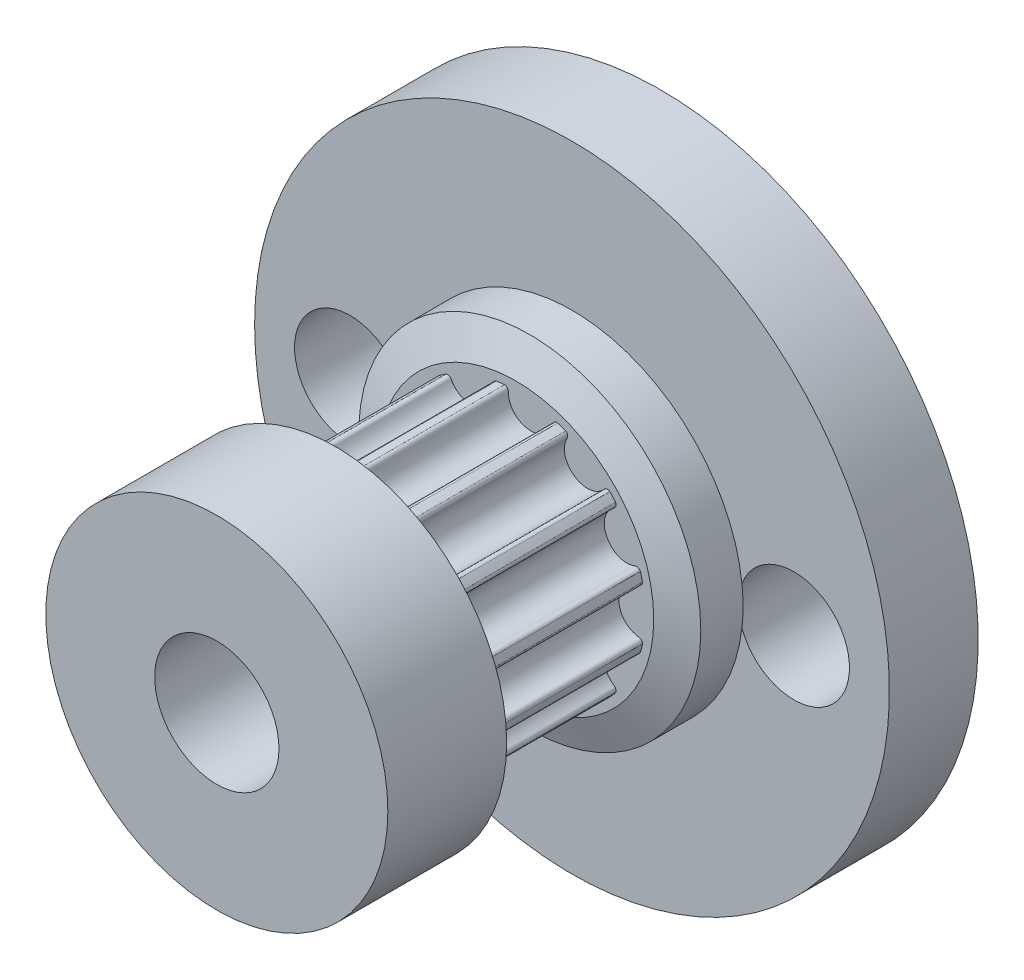
from build123d import *

# Parameters (mm, degrees)
TOOTHEXTRUDECUTGEARBELT01_DEPTH = 3.75179993
PATTERNGEARBELT01_COUNT         = 13
BOSS_EXTRUDE2_START             = -0.90326
SKETCH5_R                       = 7.705197088
BOSS_EXTRUDE2_DEPTH             = 1.90326
SKETCH6_R                       = 7.705197088
BOSS_EXTRUDE4_DEPTH             = 3.45
CUT_EXTRUDE2_START              = -15.0016
CUT_EXTRUDE2_DEPTH              = 34.543124234
BOSS_EXTRUDE3_START             = 1
SKETCH5_3_R                     = 14.3
SKETCH5_3_R_2                   = 2.5
SKETCH5_3_R_3                   = 2.8
BOSS_EXTRUDE3_DEPTH             = 4


with BuildPart() as part:
    # SketchRevolveGearBelt01 → GearBelt01 (revolve)
    with BuildSketch(Plane(origin=(0, 0, 0), x_dir=(0, 0, -1), z_dir=(1, 0, 0)), mode=Mode.PRIVATE) as gearbelt01_sk:
        Polygon((5.2757999, 0), (5.2757999, 5.190597126), (4.51379992, 5.190597126), (4.51379992, 6.055025889), (5.07653656, 7.413592317), (4.372540367, 7.705197088), (3.75179993, 6.206597107), (3.75179993, 5.825597113), (-3.75179993, 5.825597113), (-3.75179993, 6.206597107), (-4.372540367, 7.705197088), (-5.07653656, 7.413592317), (-4.51379992, 6.055025889), (-4.51379992, 5.190597126), (-5.2757999, 5.190597126), (-5.2757999, 0), align=None)
    revolve(gearbelt01_sk.sketch.rotate(Axis((0, 0, 0), (0, 0, -1)), 90), axis=Axis((0, 0, 0), (0, 0, -1)))

    # SketchToothGearBelt01 → ToothExtrudeCutGearBelt01 (cut, symmetric)
    with BuildSketch(Plane.XY):
        with BuildLine():
            ThreePointArc((5.694892079, 1.238985826), (5.82811133, 0), (5.694892079, -1.238985826))
            add(Edge.make_bspline(
                [(5.694892079, -1.238985826), (5.697177057, -1.228489495), (5.699194946, -1.212438974), (5.699015589, -1.190934318), (5.697447837, -1.174881659), (5.694459096, -1.159031946), (5.690073082, -1.143510711), (5.684324518, -1.128440876), (5.677258937, -1.113941791), (5.668932293, -1.100128287), (5.659410534, -1.087109759), (5.648769066, -1.07498933), (5.637092178, -1.063862917), (5.624472313, -1.053818916), (5.611009544, -1.044935833), (5.596810022, -1.03728791), (5.58198796, -1.030921195), (5.566654196, -1.025940308), (5.55095461, -1.022182426), (5.517566972, -1.018537534), (5.464967856, -1.005661424), (5.391433133, -0.99322849), (5.316880193, -0.971191628), (5.244078819, -0.944232687), (5.173663428, -0.911435203), (5.106015211, -0.873290054), (5.04156233, -0.829953387), (4.980696233, -0.781711646), (4.923790969, -0.728854955), (4.87119508, -0.671708794), (4.823231033, -0.610623043), (4.780192773, -0.545972238), (4.74234423, -0.478152621), (4.709916952, -0.407579931), (4.683111362, -0.334686642), (4.662085571, -0.259919934), (4.646991584, -0.183736684), (4.637835603, -0.106609111), (4.635765562, -0.050027961), (4.635859666, -0.014500084), (4.635846864, 0), (4.635859666, 0.014500084), (4.635765562, 0.050027961), (4.637835603, 0.106609111), (4.646991584, 0.183736684), (4.662085571, 0.259919934), (4.683111362, 0.334686642), (4.709916952, 0.407579931), (4.74234423, 0.478152621), (4.780192773, 0.545972238), (4.823231033, 0.610623043), (4.87119508, 0.671708794), (4.923790969, 0.728854955), (4.980696233, 0.781711646), (5.04156233, 0.829953387), (5.106015211, 0.873290054), (5.173663428, 0.911435203), (5.244078819, 0.944232687), (5.316880193, 0.971191628), (5.391433133, 0.99322849), (5.464967856, 1.005661424), (5.517566972, 1.018537534), (5.55095461, 1.022182426), (5.566654196, 1.025940308), (5.58198796, 1.030921195), (5.596810022, 1.03728791), (5.611009544, 1.044935833), (5.624472313, 1.053818916), (5.637092178, 1.063862917), (5.648769066, 1.07498933), (5.659410534, 1.087109759), (5.668932293, 1.100128287), (5.677258937, 1.113941791), (5.684324518, 1.128440876), (5.690073082, 1.143510711), (5.694459096, 1.159031946), (5.697447837, 1.174881659), (5.699015589, 1.190934318), (5.699194946, 1.212438974), (5.697177057, 1.228489495), (5.694892079, 1.238985826)],
                knots=[0, 0, 0, 0, 0.008948615, 0.013422922, 0.01789723, 0.022371537, 0.026845844, 0.031320152, 0.035794459, 0.040268767, 0.044743074, 0.049217381, 0.053691689, 0.058165996, 0.062640304, 0.067114611, 0.071588919, 0.076063226, 0.080537533, 0.085011841, 0.104016804, 0.125568346, 0.147119888, 0.168671431, 0.190222973, 0.211774515, 0.233326058, 0.2548776, 0.276429142, 0.297980685, 0.319532227, 0.341083769, 0.362635312, 0.384186854, 0.405738396, 0.427289939, 0.448841481, 0.470393024, 0.491944566, 0.495972283, 0.5, 0.504027717, 0.508055434, 0.529606976, 0.551158519, 0.572710061, 0.594261604, 0.615813146, 0.637364688, 0.658916231, 0.680467773, 0.702019315, 0.723570858, 0.7451224, 0.766673942, 0.788225485, 0.809777027, 0.831328569, 0.852880112, 0.874431654, 0.895983196, 0.914988159, 0.919462467, 0.923936774, 0.928411081, 0.932885389, 0.937359696, 0.941834004, 0.946308311, 0.950782619, 0.955256926, 0.959731233, 0.964205541, 0.968679848, 0.973154156, 0.977628463, 0.98210277, 0.986577078, 0.991051385, 1, 1, 1, 1], degree=3))
        make_face()
    toothextrudecutgearbelt01 = extrude(amount=TOOTHEXTRUDECUTGEARBELT01_DEPTH, both=True, mode=Mode.SUBTRACT)

    # PatternGearBelt01: ToothExtrudeCutGearBelt01 ×13 about axis
    patterngearbelt01_axis = Axis((0, 0, 55), (0, 0, -1))
    for i in range(1, PATTERNGEARBELT01_COUNT):
        add(toothextrudecutgearbelt01.rotate(patterngearbelt01_axis, i * 360 / PATTERNGEARBELT01_COUNT), mode=Mode.SUBTRACT)

    # Sketch5 → Boss-Extrude2 (add)
    with BuildSketch(Plane(origin=(0, 0, -5.2757999), x_dir=(-1, 0, 0), z_dir=(0, 0, -1)).offset(BOSS_EXTRUDE2_START)):
        with Locations(Location((0, 0, 0), (0, 0, 180))):
            Circle(SKETCH5_R)
    boss_extrude2 = extrude(amount=BOSS_EXTRUDE2_DEPTH)

    # Mirror1: Boss-Extrude2 across plane
    add(boss_extrude2.mirror(Plane.XY))

    # Sketch6 → Boss-Extrude4 (add)
    with BuildSketch(Plane.XY.offset(6.2757999)):
        Circle(SKETCH6_R)
    extrude(amount=BOSS_EXTRUDE4_DEPTH)

    # Sketch5<4> → Cut-Extrude2 (cut, through all)
    with BuildSketch(Plane(origin=(0, 0, -5.2757999), x_dir=(-1, 0, 0), z_dir=(0, 0, -1)).offset(CUT_EXTRUDE2_START)):
        with BuildLine():
            ThreePointArc((2.8, 0), (0, 2.8), (-2.8, 0))
            Line((-2.8, 0), (2.8, 0))
        make_face()
        with BuildLine():
            Line((2.8, 0), (-2.8, 0))
            ThreePointArc((-2.8, 0), (0, -2.8), (2.8, 0))
        make_face()
    extrude(amount=CUT_EXTRUDE2_DEPTH, mode=Mode.SUBTRACT)

    # Sketch5<3> → Boss-Extrude3 (add)
    with BuildSketch(Plane(origin=(0, 0, -5.2757999), x_dir=(-1, 0, 0), z_dir=(0, 0, -1)).offset(BOSS_EXTRUDE3_START)):
        Circle(SKETCH5_3_R)
        with Locations(Location((-10, 0, 0), (0, 0, 20.347868317))):
            Circle(SKETCH5_3_R_2, mode=Mode.SUBTRACT)
        with Locations(Location((10, 0, 0), (0, 0, 200.347868317))):
            Circle(SKETCH5_3_R_2, mode=Mode.SUBTRACT)
        with Locations(Location((0, 0, 0), (0, 0, 180))):
            Circle(SKETCH5_3_R_3, mode=Mode.SUBTRACT)
    extrude(amount=BOSS_EXTRUDE3_DEPTH)


solid = part.part
